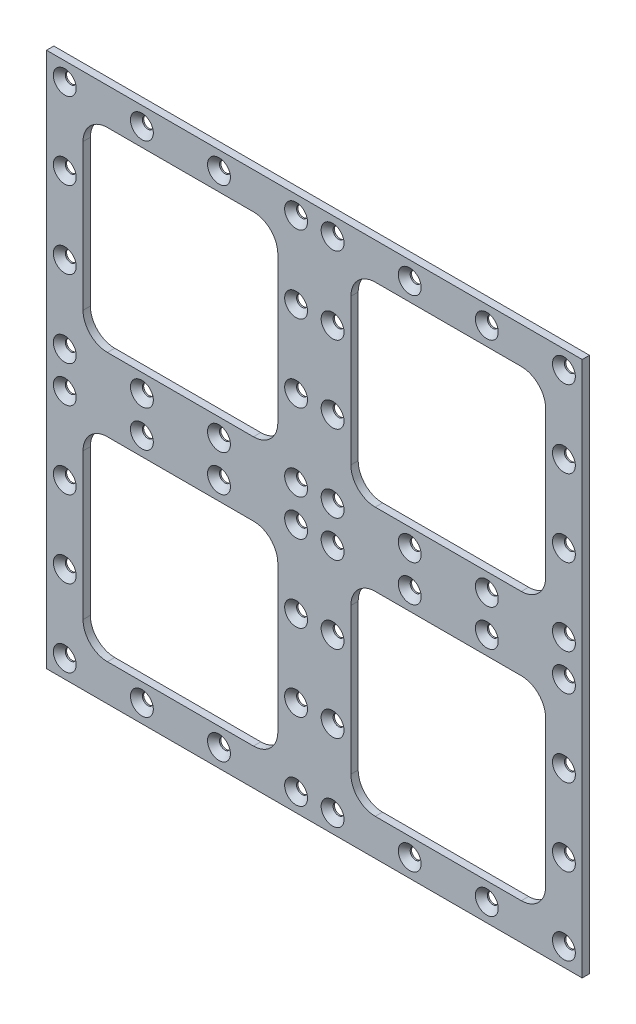
from build123d import *

# Parameters (mm, degrees)
SKETCH1_W              = 220
SKETCH1_H              = 220
BOSS_EXTRUDE1_DEPTH    = 3
SKETCH2_W              = 80
SKETCH2_H              = 80
CUT_EXTRUDE2_DEPTH     = 156.592416268
FILLET1_R              = 10
LPATTERN2_COUNT        = 2
LPATTERN2_PITCH        = 110
LPATTERN2_COUNT_DIR2   = 2
LPATTERN2_PITCH_DIR2   = 110
FILLET1_OF_LPATTERN2_R = 10
LPATTERN8_COUNT        = 4
LPATTERN8_PITCH        = 31.666666667
LPATTERN8_COUNT_DIR2   = 4
LPATTERN8_PITCH_DIR2   = 31.666666667


with BuildPart() as part:
    # Sketch1 → Boss-Extrude1 (new body)
    with BuildSketch(Plane.XY):
        Rectangle(SKETCH1_W, SKETCH1_H)
    extrude(amount=BOSS_EXTRUDE1_DEPTH)

    # Sketch2 → Cut-Extrude2 (cut, through all)
    with BuildSketch(Plane.XY):
        with Locations((-55, 55)):
            Rectangle(SKETCH2_W, SKETCH2_H)
    cut_extrude2 = extrude(amount=CUT_EXTRUDE2_DEPTH, mode=Mode.SUBTRACT)

    # Fillet1
    fillet1_edges = [part.edges().sort_by_distance(p)[0] for p in [
        (-95, 95, 1.5),
        (-15, 95, 1.5),
        (-15, 15, 1.5),
        (-95, 15, 1.5),
    ]]
    fillet(fillet1_edges, radius=FILLET1_R)

    # LPattern2: Cut-Extrude2 2 × 2
    with Locations(*[(j * LPATTERN2_PITCH_DIR2, -i * LPATTERN2_PITCH, 0) for i in range(LPATTERN2_COUNT) for j in range(LPATTERN2_COUNT_DIR2) if (i, j) != (0, 0)]):
        add(cut_extrude2, mode=Mode.SUBTRACT)

    # Fillet1 of LPattern2
    fillet1_of_lpattern2_edges = [part.edges().sort_by_distance(p)[0] for p in [
        (15, 95, 1.5),
        (95, 95, 1.5),
        (95, 15, 1.5),
        (15, 15, 1.5),
        (-95, -15, 1.5),
        (-15, -15, 1.5),
        (-15, -95, 1.5),
        (-95, -95, 1.5),
        (15, -15, 1.5),
        (95, -15, 1.5),
        (95, -95, 1.5),
        (15, -95, 1.5),
    ]]
    fillet(fillet1_of_lpattern2_edges, radius=FILLET1_OF_LPATTERN2_R)

    # Sketch12 → CSK for M4 Flat Head Machine Screw4 (revolve, cut)
    with BuildSketch(Plane(origin=(-102.5, 102.5, 3), x_dir=(0, -1, 0), z_dir=(1, 0, 0))):
        Polygon((0, 0), (0, 3), (2.25, 3), (2.25, 2.45), (4.7, 0), align=None)
    csk_for_m4_flat_head_machine_screw4 = revolve(axis=Axis((-102.5, 102.5, 9.35), (0, 0, -1)), mode=Mode.SUBTRACT)

    # LPattern8: CSK for M4 Flat Head Machine Screw4 4 × 4, 4 skipped
    with Locations(*[(i * LPATTERN8_PITCH, -j * LPATTERN8_PITCH_DIR2, 0) for i in range(LPATTERN8_COUNT) for j in range(LPATTERN8_COUNT_DIR2) if (i, j) not in ((0, 0), (1, 1), (1, 2), (2, 1), (2, 2))]):
        add(csk_for_m4_flat_head_machine_screw4, mode=Mode.SUBTRACT)

    # Mirror1 copy 1 sketch → Mirror1 copy 1 (revolve, cut)
    with BuildSketch(Plane(origin=(102.5, 70.833333333, 3), x_dir=(0, -1, 0), z_dir=(-1, 0, 0))):
        Polygon((0, 0), (0, -3), (2.25, -3), (2.25, -2.45), (4.7, 0), align=None)
    revolve(axis=Axis((102.5, 70.833333333, 9.35), (0, 0, 1)), mode=Mode.SUBTRACT)

    # Mirror1 copy 2 sketch → Mirror1 copy 2 (revolve, cut)
    with BuildSketch(Plane(origin=(102.5, 39.166666667, 3), x_dir=(0, -1, 0), z_dir=(-1, 0, 0))):
        Polygon((0, 0), (0, -3), (2.25, -3), (2.25, -2.45), (4.7, 0), align=None)
    revolve(axis=Axis((102.5, 39.166666667, 9.35), (0, 0, 1)), mode=Mode.SUBTRACT)

    # Mirror1 copy 3 sketch → Mirror1 copy 3 (revolve, cut)
    with BuildSketch(Plane(origin=(102.5, 7.5, 3), x_dir=(0, -1, 0), z_dir=(-1, 0, 0))):
        Polygon((0, 0), (0, -3), (2.25, -3), (2.25, -2.45), (4.7, 0), align=None)
    revolve(axis=Axis((102.5, 7.5, 9.35), (0, 0, 1)), mode=Mode.SUBTRACT)

    # Mirror1 copy 4 sketch → Mirror1 copy 4 (revolve, cut)
    with BuildSketch(Plane(origin=(70.833333333, 102.5, 3), x_dir=(0, -1, 0), z_dir=(-1, 0, 0))):
        Polygon((0, 0), (0, -3), (2.25, -3), (2.25, -2.45), (4.7, 0), align=None)
    revolve(axis=Axis((70.833333333, 102.5, 9.35), (0, 0, 1)), mode=Mode.SUBTRACT)

    # Mirror1 copy 5 sketch → Mirror1 copy 5 (revolve, cut)
    with BuildSketch(Plane(origin=(70.833333333, 7.5, 3), x_dir=(0, -1, 0), z_dir=(-1, 0, 0))):
        Polygon((0, 0), (0, -3), (2.25, -3), (2.25, -2.45), (4.7, 0), align=None)
    revolve(axis=Axis((70.833333333, 7.5, 9.35), (0, 0, 1)), mode=Mode.SUBTRACT)

    # Mirror1 copy 6 sketch → Mirror1 copy 6 (revolve, cut)
    with BuildSketch(Plane(origin=(39.166666667, 102.5, 3), x_dir=(0, -1, 0), z_dir=(-1, 0, 0))):
        Polygon((0, 0), (0, -3), (2.25, -3), (2.25, -2.45), (4.7, 0), align=None)
    revolve(axis=Axis((39.166666667, 102.5, 9.35), (0, 0, 1)), mode=Mode.SUBTRACT)

    # Mirror1 copy 7 sketch → Mirror1 copy 7 (revolve, cut)
    with BuildSketch(Plane(origin=(39.166666667, 7.5, 3), x_dir=(0, -1, 0), z_dir=(-1, 0, 0))):
        Polygon((0, 0), (0, -3), (2.25, -3), (2.25, -2.45), (4.7, 0), align=None)
    revolve(axis=Axis((39.166666667, 7.5, 9.35), (0, 0, 1)), mode=Mode.SUBTRACT)

    # Mirror1 copy 8 sketch → Mirror1 copy 8 (revolve, cut)
    with BuildSketch(Plane(origin=(7.5, 102.5, 3), x_dir=(0, -1, 0), z_dir=(-1, 0, 0))):
        Polygon((0, 0), (0, -3), (2.25, -3), (2.25, -2.45), (4.7, 0), align=None)
    revolve(axis=Axis((7.5, 102.5, 9.35), (0, 0, 1)), mode=Mode.SUBTRACT)

    # Mirror1 copy 9 sketch → Mirror1 copy 9 (revolve, cut)
    with BuildSketch(Plane(origin=(7.5, 70.833333333, 3), x_dir=(0, -1, 0), z_dir=(-1, 0, 0))):
        Polygon((0, 0), (0, -3), (2.25, -3), (2.25, -2.45), (4.7, 0), align=None)
    revolve(axis=Axis((7.5, 70.833333333, 9.35), (0, 0, 1)), mode=Mode.SUBTRACT)

    # Mirror1 copy 10 sketch → Mirror1 copy 10 (revolve, cut)
    with BuildSketch(Plane(origin=(7.5, 39.166666667, 3), x_dir=(0, -1, 0), z_dir=(-1, 0, 0))):
        Polygon((0, 0), (0, -3), (2.25, -3), (2.25, -2.45), (4.7, 0), align=None)
    revolve(axis=Axis((7.5, 39.166666667, 9.35), (0, 0, 1)), mode=Mode.SUBTRACT)

    # Mirror1 copy 11 sketch → Mirror1 copy 11 (revolve, cut)
    with BuildSketch(Plane(origin=(7.5, 7.5, 3), x_dir=(0, -1, 0), z_dir=(-1, 0, 0))):
        Polygon((0, 0), (0, -3), (2.25, -3), (2.25, -2.45), (4.7, 0), align=None)
    revolve(axis=Axis((7.5, 7.5, 9.35), (0, 0, 1)), mode=Mode.SUBTRACT)

    # Mirror1 copy 12 sketch → Mirror1 copy 12 (revolve, cut)
    with BuildSketch(Plane(origin=(102.5, 102.5, 3), x_dir=(0, -1, 0), z_dir=(-1, 0, 0))):
        Polygon((0, 0), (0, -3), (2.25, -3), (2.25, -2.45), (4.7, 0), align=None)
    revolve(axis=Axis((102.5, 102.5, 9.35), (0, 0, 1)), mode=Mode.SUBTRACT)

    # Mirror1 at the second plane copy 1 sketc → Mirror1 at the second plane copy 1 (revolve, cut)
    with BuildSketch(Plane(origin=(-102.5, -70.833333333, 3), x_dir=(0, 1, 0), z_dir=(1, 0, 0))):
        Polygon((0, 0), (0, -3), (2.25, -3), (2.25, -2.45), (4.7, 0), align=None)
    revolve(axis=Axis((-102.5, -70.833333333, 9.35), (0, 0, 1)), mode=Mode.SUBTRACT)

    # Mirror1 at the second plane copy 2 sketc → Mirror1 at the second plane copy 2 (revolve, cut)
    with BuildSketch(Plane(origin=(-102.5, -39.166666667, 3), x_dir=(0, 1, 0), z_dir=(1, 0, 0))):
        Polygon((0, 0), (0, -3), (2.25, -3), (2.25, -2.45), (4.7, 0), align=None)
    revolve(axis=Axis((-102.5, -39.166666667, 9.35), (0, 0, 1)), mode=Mode.SUBTRACT)

    # Mirror1 at the second plane copy 3 sketc → Mirror1 at the second plane copy 3 (revolve, cut)
    with BuildSketch(Plane(origin=(-102.5, -7.5, 3), x_dir=(0, 1, 0), z_dir=(1, 0, 0))):
        Polygon((0, 0), (0, -3), (2.25, -3), (2.25, -2.45), (4.7, 0), align=None)
    revolve(axis=Axis((-102.5, -7.5, 9.35), (0, 0, 1)), mode=Mode.SUBTRACT)

    # Mirror1 at the second plane copy 4 sketc → Mirror1 at the second plane copy 4 (revolve, cut)
    with BuildSketch(Plane(origin=(-70.833333333, -102.5, 3), x_dir=(0, 1, 0), z_dir=(1, 0, 0))):
        Polygon((0, 0), (0, -3), (2.25, -3), (2.25, -2.45), (4.7, 0), align=None)
    revolve(axis=Axis((-70.833333333, -102.5, 9.35), (0, 0, 1)), mode=Mode.SUBTRACT)

    # Mirror1 at the second plane copy 5 sketc → Mirror1 at the second plane copy 5 (revolve, cut)
    with BuildSketch(Plane(origin=(-70.833333333, -7.5, 3), x_dir=(0, 1, 0), z_dir=(1, 0, 0))):
        Polygon((0, 0), (0, -3), (2.25, -3), (2.25, -2.45), (4.7, 0), align=None)
    revolve(axis=Axis((-70.833333333, -7.5, 9.35), (0, 0, 1)), mode=Mode.SUBTRACT)

    # Mirror1 at the second plane copy 6 sketc → Mirror1 at the second plane copy 6 (revolve, cut)
    with BuildSketch(Plane(origin=(-39.166666667, -102.5, 3), x_dir=(0, 1, 0), z_dir=(1, 0, 0))):
        Polygon((0, 0), (0, -3), (2.25, -3), (2.25, -2.45), (4.7, 0), align=None)
    revolve(axis=Axis((-39.166666667, -102.5, 9.35), (0, 0, 1)), mode=Mode.SUBTRACT)

    # Mirror1 at the second plane copy 7 sketc → Mirror1 at the second plane copy 7 (revolve, cut)
    with BuildSketch(Plane(origin=(-39.166666667, -7.5, 3), x_dir=(0, 1, 0), z_dir=(1, 0, 0))):
        Polygon((0, 0), (0, -3), (2.25, -3), (2.25, -2.45), (4.7, 0), align=None)
    revolve(axis=Axis((-39.166666667, -7.5, 9.35), (0, 0, 1)), mode=Mode.SUBTRACT)

    # Mirror1 at the second plane copy 8 sketc → Mirror1 at the second plane copy 8 (revolve, cut)
    with BuildSketch(Plane(origin=(-7.5, -102.5, 3), x_dir=(0, 1, 0), z_dir=(1, 0, 0))):
        Polygon((0, 0), (0, -3), (2.25, -3), (2.25, -2.45), (4.7, 0), align=None)
    revolve(axis=Axis((-7.5, -102.5, 9.35), (0, 0, 1)), mode=Mode.SUBTRACT)

    # Mirror1 at the second plane copy 9 sketc → Mirror1 at the second plane copy 9 (revolve, cut)
    with BuildSketch(Plane(origin=(-7.5, -70.833333333, 3), x_dir=(0, 1, 0), z_dir=(1, 0, 0))):
        Polygon((0, 0), (0, -3), (2.25, -3), (2.25, -2.45), (4.7, 0), align=None)
    revolve(axis=Axis((-7.5, -70.833333333, 9.35), (0, 0, 1)), mode=Mode.SUBTRACT)

    # Mirror1 at the second plane copy 10 sket → Mirror1 at the second plane copy 10 (revolve, cut)
    with BuildSketch(Plane(origin=(-7.5, -39.166666667, 3), x_dir=(0, 1, 0), z_dir=(1, 0, 0))):
        Polygon((0, 0), (0, -3), (2.25, -3), (2.25, -2.45), (4.7, 0), align=None)
    revolve(axis=Axis((-7.5, -39.166666667, 9.35), (0, 0, 1)), mode=Mode.SUBTRACT)

    # Mirror1 at the second plane copy 11 sket → Mirror1 at the second plane copy 11 (revolve, cut)
    with BuildSketch(Plane(origin=(-7.5, -7.5, 3), x_dir=(0, 1, 0), z_dir=(1, 0, 0))):
        Polygon((0, 0), (0, -3), (2.25, -3), (2.25, -2.45), (4.7, 0), align=None)
    revolve(axis=Axis((-7.5, -7.5, 9.35), (0, 0, 1)), mode=Mode.SUBTRACT)

    # Mirror1 at the second plane copy 12 sket → Mirror1 at the second plane copy 12 (revolve, cut)
    with BuildSketch(Plane(origin=(-102.5, -102.5, 3), x_dir=(0, 1, 0), z_dir=(1, 0, 0))):
        Polygon((0, 0), (0, -3), (2.25, -3), (2.25, -2.45), (4.7, 0), align=None)
    revolve(axis=Axis((-102.5, -102.5, 9.35), (0, 0, 1)), mode=Mode.SUBTRACT)

    # Mirror1 at the second plane copy 13 sket → Mirror1 at the second plane copy 13 (revolve, cut)
    with BuildSketch(Plane(origin=(102.5, -70.833333333, 3), x_dir=(0, 1, 0), z_dir=(-1, 0, 0))):
        Polygon((0, 0), (0, 3), (2.25, 3), (2.25, 2.45), (4.7, 0), align=None)
    revolve(axis=Axis((102.5, -70.833333333, 9.35), (0, 0, -1)), mode=Mode.SUBTRACT)

    # Mirror1 at the second plane copy 14 sket → Mirror1 at the second plane copy 14 (revolve, cut)
    with BuildSketch(Plane(origin=(102.5, -39.166666667, 3), x_dir=(0, 1, 0), z_dir=(-1, 0, 0))):
        Polygon((0, 0), (0, 3), (2.25, 3), (2.25, 2.45), (4.7, 0), align=None)
    revolve(axis=Axis((102.5, -39.166666667, 9.35), (0, 0, -1)), mode=Mode.SUBTRACT)

    # Mirror1 at the second plane copy 15 sket → Mirror1 at the second plane copy 15 (revolve, cut)
    with BuildSketch(Plane(origin=(102.5, -7.5, 3), x_dir=(0, 1, 0), z_dir=(-1, 0, 0))):
        Polygon((0, 0), (0, 3), (2.25, 3), (2.25, 2.45), (4.7, 0), align=None)
    revolve(axis=Axis((102.5, -7.5, 9.35), (0, 0, -1)), mode=Mode.SUBTRACT)

    # Mirror1 at the second plane copy 16 sket → Mirror1 at the second plane copy 16 (revolve, cut)
    with BuildSketch(Plane(origin=(70.833333333, -102.5, 3), x_dir=(0, 1, 0), z_dir=(-1, 0, 0))):
        Polygon((0, 0), (0, 3), (2.25, 3), (2.25, 2.45), (4.7, 0), align=None)
    revolve(axis=Axis((70.833333333, -102.5, 9.35), (0, 0, -1)), mode=Mode.SUBTRACT)

    # Mirror1 at the second plane copy 17 sket → Mirror1 at the second plane copy 17 (revolve, cut)
    with BuildSketch(Plane(origin=(70.833333333, -7.5, 3), x_dir=(0, 1, 0), z_dir=(-1, 0, 0))):
        Polygon((0, 0), (0, 3), (2.25, 3), (2.25, 2.45), (4.7, 0), align=None)
    revolve(axis=Axis((70.833333333, -7.5, 9.35), (0, 0, -1)), mode=Mode.SUBTRACT)

    # Mirror1 at the second plane copy 18 sket → Mirror1 at the second plane copy 18 (revolve, cut)
    with BuildSketch(Plane(origin=(39.166666667, -102.5, 3), x_dir=(0, 1, 0), z_dir=(-1, 0, 0))):
        Polygon((0, 0), (0, 3), (2.25, 3), (2.25, 2.45), (4.7, 0), align=None)
    revolve(axis=Axis((39.166666667, -102.5, 9.35), (0, 0, -1)), mode=Mode.SUBTRACT)

    # Mirror1 at the second plane copy 19 sket → Mirror1 at the second plane copy 19 (revolve, cut)
    with BuildSketch(Plane(origin=(39.166666667, -7.5, 3), x_dir=(0, 1, 0), z_dir=(-1, 0, 0))):
        Polygon((0, 0), (0, 3), (2.25, 3), (2.25, 2.45), (4.7, 0), align=None)
    revolve(axis=Axis((39.166666667, -7.5, 9.35), (0, 0, -1)), mode=Mode.SUBTRACT)

    # Mirror1 at the second plane copy 20 sket → Mirror1 at the second plane copy 20 (revolve, cut)
    with BuildSketch(Plane(origin=(7.5, -102.5, 3), x_dir=(0, 1, 0), z_dir=(-1, 0, 0))):
        Polygon((0, 0), (0, 3), (2.25, 3), (2.25, 2.45), (4.7, 0), align=None)
    revolve(axis=Axis((7.5, -102.5, 9.35), (0, 0, -1)), mode=Mode.SUBTRACT)

    # Mirror1 at the second plane copy 21 sket → Mirror1 at the second plane copy 21 (revolve, cut)
    with BuildSketch(Plane(origin=(7.5, -70.833333333, 3), x_dir=(0, 1, 0), z_dir=(-1, 0, 0))):
        Polygon((0, 0), (0, 3), (2.25, 3), (2.25, 2.45), (4.7, 0), align=None)
    revolve(axis=Axis((7.5, -70.833333333, 9.35), (0, 0, -1)), mode=Mode.SUBTRACT)

    # Mirror1 at the second plane copy 22 sket → Mirror1 at the second plane copy 22 (revolve, cut)
    with BuildSketch(Plane(origin=(7.5, -39.166666667, 3), x_dir=(0, 1, 0), z_dir=(-1, 0, 0))):
        Polygon((0, 0), (0, 3), (2.25, 3), (2.25, 2.45), (4.7, 0), align=None)
    revolve(axis=Axis((7.5, -39.166666667, 9.35), (0, 0, -1)), mode=Mode.SUBTRACT)

    # Mirror1 at the second plane copy 23 sket → Mirror1 at the second plane copy 23 (revolve, cut)
    with BuildSketch(Plane(origin=(7.5, -7.5, 3), x_dir=(0, 1, 0), z_dir=(-1, 0, 0))):
        Polygon((0, 0), (0, 3), (2.25, 3), (2.25, 2.45), (4.7, 0), align=None)
    revolve(axis=Axis((7.5, -7.5, 9.35), (0, 0, -1)), mode=Mode.SUBTRACT)

    # Mirror1 at the second plane copy 24 sket → Mirror1 at the second plane copy 24 (revolve, cut)
    with BuildSketch(Plane(origin=(102.5, -102.5, 3), x_dir=(0, 1, 0), z_dir=(-1, 0, 0))):
        Polygon((0, 0), (0, 3), (2.25, 3), (2.25, 2.45), (4.7, 0), align=None)
    revolve(axis=Axis((102.5, -102.5, 9.35), (0, 0, -1)), mode=Mode.SUBTRACT)

    # Mirror1 at the second plane copy 25 sket → Mirror1 at the second plane copy 25 (revolve, cut)
    with BuildSketch(Plane(origin=(-102.5, -102.5, 3), x_dir=(0, 1, 0), z_dir=(1, 0, 0))):
        Polygon((0, 0), (0, -3), (2.25, -3), (2.25, -2.45), (4.7, 0), align=None)
    revolve(axis=Axis((-102.5, -102.5, 9.35), (0, 0, 1)), mode=Mode.SUBTRACT)


solid = part.part
